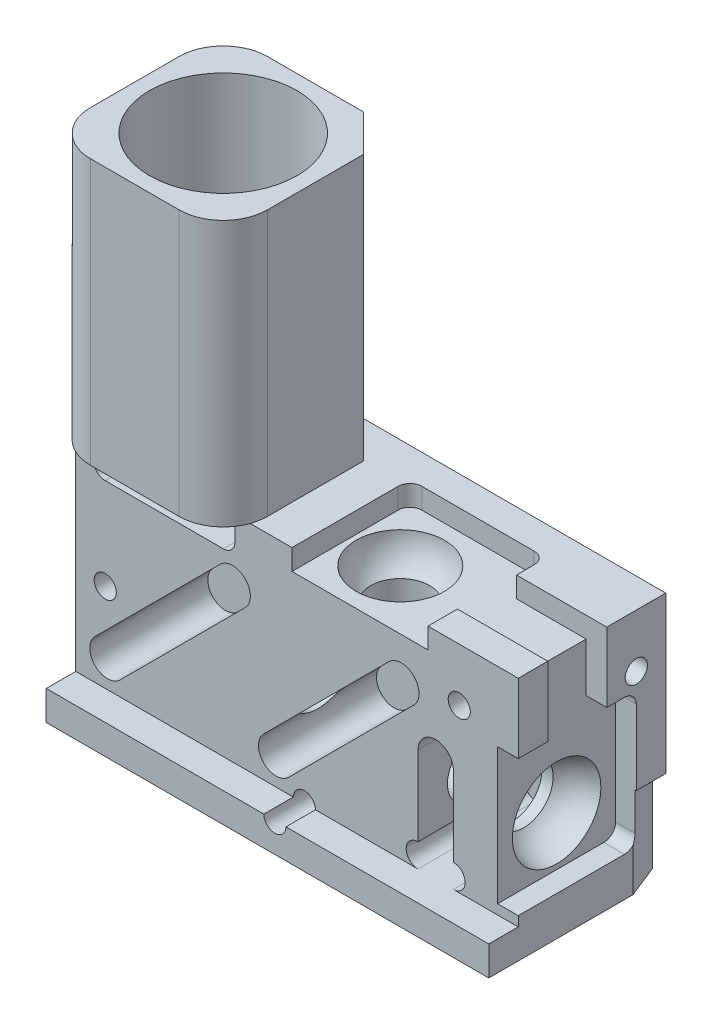
from build123d import *

# Parameters (mm, degrees)
SKETCH1_W                        = 15
SKETCH1_H                        = 6
MAIN_BODY_EXT_DEPTH              = 8.3
EMISSION_PATH_EXT_DEPTH          = 9
SKETCH3_R                        = 1.25
EMISSION_AND_GRIN_CUT_DEPTH      = 20.092931
SKETCH4_R                        = 1
DRUM_LENS_CUT_DEPTH              = 13
SKETCH41_R                       = 1
ADDTL_LIGHT_SOURCE_DEPTH         = 5
SKETCH5_W                        = 15
SKETCH5_H                        = 7.3
FILTERSET_CUT1_DEPTH             = 1
FILTERSET_CUT2_DEPTH             = 4
SKETCH10_R                       = 2.5
EMISSION_LENS_CUT_DEPTH          = 8.5
SKETCH15_R                       = 0.795
MAGNETS_CUT_DEPTH                = 0.9
SCREW_HOLES_CUT_DEPTH            = 20.507434
SCREW_HOLES_CUT_DEPTH_BACK       = 3
SKETCH18_R                       = 0.375
EXTERNAL_FILLET_1_R              = 1.5
CUT_EXTRUDE8_DEPTH               = 14.011149
CUT_EXTRUDE8_DEPTH_BACK          = 4
SKETCH28_R                       = 1.5
CUT_EXTRUDE9_DEPTH               = 3
CUT_EXTRUDE_ORIGINAL_LIGHT_DEPTH = 0.7
CUT_EXTRUDE_ADDTL_LIGHT_DEPTH    = 0.7
SKETCH29_R                       = 0.375
CUT_EXTRUDE11_DEPTH              = 2.5
SKETCH32_W                       = 2
SKETCH32_H                       = 2.36
CUT_EXTRUDE14_DEPTH              = 0.7
SKETCH45_W                       = 2.36
SKETCH45_H                       = 2
CUT_EXTRUDE19_DEPTH              = 0.7
CUT_EXTRUDE16_DEPTH              = 9
CUT_EXTRUDE17_REACH              = 13.945
SKETCH37_R                       = 2


with BuildPart() as part:
    # Sketch1 → Main Body Ext (new body)
    with BuildSketch(Plane(origin=(0, 0, 0), x_dir=(1, 0, 0), z_dir=(0, 1, 0))):
        Rectangle(SKETCH1_W, SKETCH1_H)
    extrude(amount=MAIN_BODY_EXT_DEPTH)

    # Sketch8 → Emission Path Ext (add)
    with BuildSketch(Plane(origin=(0, 8.3, 0), x_dir=(1, 0, 0), z_dir=(0, 1, 0))):
        Polygon((-2.75, 3), (-1.5, 1.75), (-1.5, -3), (-7.5, -3), (-7.5, 3), align=None)
    extrude(amount=EMISSION_PATH_EXT_DEPTH)

    # Sketch3 → Emission and Grin Cut (cut, through all)
    with BuildSketch(Plane.XZ):
        with Locations(Location((-4.5, 0, 0), (0, 0, 270))):
            Circle(SKETCH3_R)
    extrude(amount=-EMISSION_AND_GRIN_CUT_DEPTH, mode=Mode.SUBTRACT)

    # Sketch4 → Drum Lens Cut (cut)
    with BuildSketch(Plane(origin=(7.5, 0, 0), x_dir=(0, 0, -1), z_dir=(1, 0, 0))):
        with Locations((0, 3)):
            Circle(SKETCH4_R)
    extrude(amount=-DRUM_LENS_CUT_DEPTH, mode=Mode.SUBTRACT)

    # Sketch41 → Addtl Light Source (cut)
    with BuildSketch(Plane(origin=(0, 8.3, 0), x_dir=(1, 0, 0), z_dir=(0, 1, 0))):
        with Locations(Location((1.5, 0, 0), (0, 0, 270))):
            Circle(SKETCH41_R)
    extrude(amount=-ADDTL_LIGHT_SOURCE_DEPTH, mode=Mode.SUBTRACT)

    # Sketch5 → FilterSet Cut1 (cut)
    with BuildSketch(Plane.XY.offset(3)):
        with Locations((0, 4.65)):
            Rectangle(SKETCH5_W, SKETCH5_H)
    extrude(amount=-FILTERSET_CUT1_DEPTH, mode=Mode.SUBTRACT)

    # Sketch6 → FilterSet Cut2 (cut)
    with BuildSketch(Plane.XY.offset(2)):
        with BuildLine():
            Line((5.3, 4.5), (5.3, 1.8))
            ThreePointArc((5.3, 1.8), (5.7, 1.4), (5.3, 1))
            Line((5.3, 1), (4.1, 1))
            ThreePointArc((4.1, 1), (3.7, 1.4), (4.1, 1.8))
            Line((4.1, 1.8), (4.1, 4.5))
            ThreePointArc((4.1, 4.5), (4.7, 5.1), (5.3, 4.5))
        make_face()
        with BuildLine():
            Line((-6.9, 7.9), (-6.9, 7.5))
            ThreePointArc((-6.9, 7.5), (-6.782843, 7.217157), (-6.5, 7.1))
            Line((-6.5, 7.1), (-2.5, 7.1))
            ThreePointArc((-2.5, 7.1), (-2.217157, 7.217157), (-2.1, 7.5))
            Line((-2.1, 7.5), (-2.1, 7.9))
            ThreePointArc((-2.1, 7.9), (-2.217157, 8.182843), (-2.5, 8.3))
            Line((-2.5, 8.3), (-6.5, 8.3))
            ThreePointArc((-6.5, 8.3), (-6.782843, 8.182843), (-6.9, 7.9))
        make_face()
        with BuildLine():
            Line((-2.605887, 6.591169), (-6.848528, 2.348528))
            ThreePointArc((-6.848528, 2.348528), (-6.848528, 1.5), (-6, 1.5))
            Line((-6, 1.5), (-1.757359, 5.742641))
            ThreePointArc((-1.757359, 5.742641), (-1.757359, 6.591169), (-2.605887, 6.591169))
        make_face()
        with BuildLine():
            Line((3.112092, 6.591169), (-1.130548, 2.348528))
            ThreePointArc((-1.130548, 2.348528), (-1.130548, 1.5), (-0.28202, 1.5))
            Line((-0.28202, 1.5), (3.96062, 5.742641))
            ThreePointArc((3.96062, 5.742641), (3.96062, 6.591169), (3.112092, 6.591169))
        make_face()
    extrude(amount=-FILTERSET_CUT2_DEPTH, mode=Mode.SUBTRACT)

    # Sketch10 → Emission Lens Cut (cut)
    with BuildSketch(Plane(origin=(0, 17.3, 0), x_dir=(1, 0, 0), z_dir=(0, 1, 0))):
        with Locations(Location((-4.5, 0, 0), (0, 0, 270))):
            Circle(SKETCH10_R)
    extrude(amount=-EMISSION_LENS_CUT_DEPTH, mode=Mode.SUBTRACT)

    # Sketch15 → Magnets Cut (cut)
    with BuildSketch(Plane.XZ):
        with Locations(Location((-6.25, -1.875, 0), (0, 0, 270))):
            Circle(SKETCH15_R)
        with Locations(Location((-6.25, 1.875, 0), (0, 0, 270))):
            Circle(SKETCH15_R)
        with Locations(Location((2.5, 0, 0), (0, 0, 270))):
            Circle(SKETCH15_R)
    extrude(amount=-MAGNETS_CUT_DEPTH, mode=Mode.SUBTRACT)

    # Sketch18 → Screw Holes Cut (cut, two sides: drawn at the far end of the back side and taken through both)
    with BuildSketch(Plane.XY.offset(2).offset(-SCREW_HOLES_CUT_DEPTH_BACK)):
        with Locations(Location((-6.5, 4, 0), (0, 0, 180))):
            Circle(SKETCH18_R)
        with Locations(Location((5.5, 6.5, 0), (0, 0, 180))):
            Circle(SKETCH18_R)
        with Locations((0.25, 1)):
            Circle(SKETCH18_R)
    extrude(amount=SCREW_HOLES_CUT_DEPTH + SCREW_HOLES_CUT_DEPTH_BACK, mode=Mode.SUBTRACT)

    # External Fillet 1
    # the kernel refuses this fillet: 1.5 mm, written as the material it takes off along each edge
    with BuildSketch(Plane(origin=(-7.5, -3.75, -3), x_dir=(1, 0, 0), z_dir=(0, 1, 0))) as external_fillet_1_piece_1:
        with BuildLine():
            CenterArc((EXTERNAL_FILLET_1_R, -EXTERNAL_FILLET_1_R), EXTERNAL_FILLET_1_R, 90, 90)
            Line((0, -EXTERNAL_FILLET_1_R), (0, 0))
            Line((0, 0), (EXTERNAL_FILLET_1_R, 0))
        make_face()
    extrude(amount=24.8, mode=Mode.SUBTRACT)
    with BuildSketch(Plane(origin=(-1.5, 8.3, 3), x_dir=(0, 0, -1), z_dir=(0, 1, 0))) as external_fillet_1_piece_2:
        with BuildLine():
            CenterArc((EXTERNAL_FILLET_1_R, EXTERNAL_FILLET_1_R), EXTERNAL_FILLET_1_R, 180, 90)
            Line((0, EXTERNAL_FILLET_1_R), (0, 0))
            Line((0, 0), (EXTERNAL_FILLET_1_R, 0))
        make_face()
    extrude(amount=12.75, mode=Mode.SUBTRACT)

    # Sketch28 → Cut-Extrude8 (cut, two sides: drawn at the far end of the back side and taken through both)
    with BuildSketch(Plane(origin=(0, 7.1, 0), x_dir=(1, 0, 0), z_dir=(0, 1, 0)).offset(-CUT_EXTRUDE8_DEPTH_BACK)):
        with Locations(Location((-4.5, 0, 0), (0, 0, 180))):
            Circle(SKETCH28_R)
    extrude(amount=CUT_EXTRUDE8_DEPTH + CUT_EXTRUDE8_DEPTH_BACK, mode=Mode.SUBTRACT)

    # Sketch14 → Cut-Extrude9 (cut)
    with BuildSketch(Plane.XZ):
        Polygon((7.5, -3), (7.5, -1.891585), (7.056634, -3), align=None)
    extrude(amount=-CUT_EXTRUDE9_DEPTH, mode=Mode.SUBTRACT)

    # Sketch12 → Cut-Extrude Original Light (cut)
    with BuildSketch(Plane(origin=(7.5, 0, 0), x_dir=(0, 0, -1), z_dir=(1, 0, 0))):
        with BuildLine():
            Line((1.6, 5.94), (-1.6, 5.94))
            Line((-1.6, 5.94), (-2, 5.94))
            Line((-2, 5.94), (-2, 1.33))
            Line((-2, 1.33), (1.6, 1.33))
            ThreePointArc((1.6, 1.33), (1.882843, 1.447157), (2, 1.73))
            Line((2, 1.73), (2, 5.54))
            ThreePointArc((2, 5.54), (1.882843, 5.822843), (1.6, 5.94))
        make_face()
    extrude(amount=-CUT_EXTRUDE_ORIGINAL_LIGHT_DEPTH, mode=Mode.SUBTRACT)

    # Sketch44 → Cut-Extrude Addtl Light (cut)
    with BuildSketch(Plane(origin=(0, 8.3, 0), x_dir=(1, 0, 0), z_dir=(0, 1, 0))):
        with BuildLine():
            Line((-0.17, -2), (4.44, -2))
            Line((4.44, -2), (4.44, 1.6))
            ThreePointArc((4.44, 1.6), (4.322843, 1.882843), (4.04, 2))
            Line((4.04, 2), (0.23, 2))
            ThreePointArc((0.23, 2), (-0.052843, 1.882843), (-0.17, 1.6))
            Line((-0.17, 1.6), (-0.17, -2))
        make_face()
    extrude(amount=-CUT_EXTRUDE_ADDTL_LIGHT_DEPTH, mode=Mode.SUBTRACT)

    # Sketch29 → Cut-Extrude11 (cut)
    with BuildSketch(Plane(origin=(7.5, 0, 0), x_dir=(0, 0, -1), z_dir=(1, 0, 0))):
        with Locations((2, 6.5)):
            Circle(SKETCH29_R)
    extrude(amount=-CUT_EXTRUDE11_DEPTH, mode=Mode.SUBTRACT)

    # Sketch32 → Cut-Extrude14 (cut)
    with BuildSketch(Plane(origin=(7.5, 0, 0), x_dir=(0, 0, -1), z_dir=(1, 0, 0))):
        with Locations((0, 7.12)):
            Rectangle(SKETCH32_W, SKETCH32_H)
    extrude(amount=-CUT_EXTRUDE14_DEPTH, mode=Mode.SUBTRACT)

    # Sketch45 → Cut-Extrude19 (cut)
    with BuildSketch(Plane(origin=(0, 8.3, 0), x_dir=(1, 0, 0), z_dir=(0, 1, 0))):
        with Locations((5.62, 0)):
            Rectangle(SKETCH45_W, SKETCH45_H)
    extrude(amount=-CUT_EXTRUDE19_DEPTH, mode=Mode.SUBTRACT)

    # Sketch33 → Cut-Revolve1 (revolve, cut)
    with BuildSketch(Plane.XY, mode=Mode.PRIVATE) as cut_revolve1_sk:
        with BuildLine():
            Line((6.8, 3), (5.3, 3))
            ThreePointArc((5.3, 3), (5.73934, 4.06066), (6.8, 4.5))
            Line((6.8, 4.5), (6.8, 3))
        make_face()
    revolve(cut_revolve1_sk.sketch.rotate(Axis((6.8, 3, 0), (-1, 0, 0)), 84.26086), axis=Axis((6.8, 3, 0), (-1, 0, 0)), mode=Mode.SUBTRACT)

    # Sketch47 → Cut-Revolve2 (revolve, cut)
    with BuildSketch(Plane(origin=(1.5, 0, 0), x_dir=(0, 0, -1), z_dir=(1, 0, 0))):
        with BuildLine():
            Line((-1.5, 7.6), (0, 7.6))
            Line((0, 7.6), (0, 6.137287))
            ThreePointArc((0, 6.137287), (-1.04756, 6.563498), (-1.5, 7.6))
        make_face()
    revolve(axis=Axis((1.5, 7.6, 0), (0, -1, 0)), mode=Mode.SUBTRACT)

    # Sketch36 → Cut-Extrude16 (cut)
    with BuildSketch(Plane(origin=(0, 17.3, 0), x_dir=(1, 0, 0), z_dir=(0, 1, 0))):
        with BuildLine():
            Line((-7.5, -1.5), (-7.5, -3))
            Line((-7.5, -3), (-6, -3))
            ThreePointArc((-6, -3), (-7.06066, -2.56066), (-7.5, -1.5))
        make_face()
    extrude(amount=-CUT_EXTRUDE16_DEPTH, mode=Mode.SUBTRACT)

    # Sketch37 → Cut-Extrude17 (cut, up to next)
    with BuildSketch(Plane(origin=(0, 8.8, 0), x_dir=(1, 0, 0), z_dir=(0, 1, 0)), mode=Mode.PRIVATE) as cut_extrude17_sk1:
        with Locations(Location((-4.5, 0, 0), (0, 0, 180))):
            Circle(SKETCH37_R)
    cut_extrude17_tool1 = extrude(cut_extrude17_sk1.sketch, amount=-CUT_EXTRUDE17_REACH, mode=Mode.PRIVATE) & part.part
    add(cut_extrude17_tool1.solids().sort_by_distance((-4.5, 8.8, 0))[0], mode=Mode.SUBTRACT)


solid = part.part
